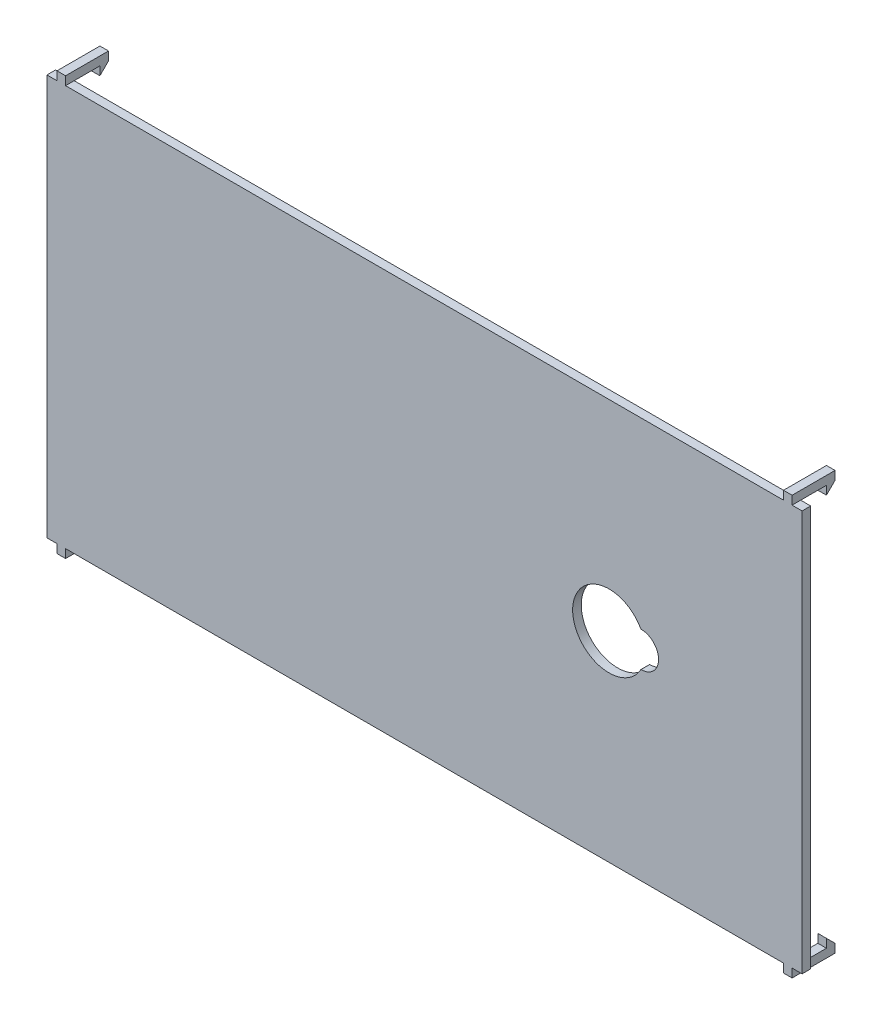
from build123d import *

# Parameters (mm, degrees)
SKETCH1_W            = 131.85
SKETCH1_H            = 70
BOSS_EXTRUDE1_DEPTH  = 1.5
CUT_EXTRUDE1_REACH   = 137.268
BOSS_EXTRUDE2_START  = -1.75
BOSS_EXTRUDE2_DEPTH  = 1.5
MIRROR2_START        = -1.75
MIRROR2_COPY_1_DEPTH = 1.5


with BuildPart() as part:
    # Sketch1 → Boss-Extrude1 (new body)
    with BuildSketch(Plane.XY):
        with Locations((55.175, 25.25)):
            Rectangle(SKETCH1_W, SKETCH1_H)
    extrude(amount=BOSS_EXTRUDE1_DEPTH)

    # Sketch2 → Cut-Extrude1 (cut, up to next)
    with BuildSketch(Plane.XY.offset(1.5), mode=Mode.PRIVATE) as cut_extrude1_sk1:
        with BuildLine():
            Line((92.957060126, 22.2), (92.9875, 22.2))
            ThreePointArc((92.9875, 22.2), (96.0375, 25.25), (92.9875, 28.3))
            Line((92.9875, 28.3), (92.957060126, 28.3))
            ThreePointArc((92.957060126, 28.3), (81.0375, 25.25), (92.957060126, 22.2))
        make_face()
    cut_extrude1_tool1 = extrude(cut_extrude1_sk1.sketch, amount=-CUT_EXTRUDE1_REACH, mode=Mode.PRIVATE) & part.part
    add(cut_extrude1_tool1.solids().sort_by_distance((87.98685, 25.25, 1.5))[0], mode=Mode.SUBTRACT)

    # Sketch3 → Boss-Extrude2 (add)
    with BuildSketch(Plane(origin=(121.1, 0, 0), x_dir=(0, 0, -1), z_dir=(1, 0, 0)).offset(BOSS_EXTRUDE2_START)):
        Polygon((-1.5, 61.75), (-1.5, 60.25), (4.5, 60.25), (4.5, 58.75), (6, 60.25), (6, 61.75), align=None)
    boss_extrude2 = extrude(amount=-BOSS_EXTRUDE2_DEPTH)

    # Mirror1: Boss-Extrude2 across plane
    add(boss_extrude2.mirror(Plane(origin=(55.175, 0, 0), x_dir=(0, 0, 1), z_dir=(1, 0, 0))))

    # Mirror2: Boss-Extrude2 across plane
    add(boss_extrude2.mirror(Plane.ZX.offset(25.25)))

    # Mirror2 copy 1 sketch → Mirror2 copy 1 (add)
    with BuildSketch(Plane(origin=(-10.75, 50.5, 0), x_dir=(0, 0, -1), z_dir=(-1, 0, 0)).offset(MIRROR2_START)):
        Polygon((-1.5, 61.75), (-1.5, 60.25), (4.5, 60.25), (4.5, 58.75), (6, 60.25), (6, 61.75), align=None)
    extrude(amount=-MIRROR2_COPY_1_DEPTH)


solid = part.part
